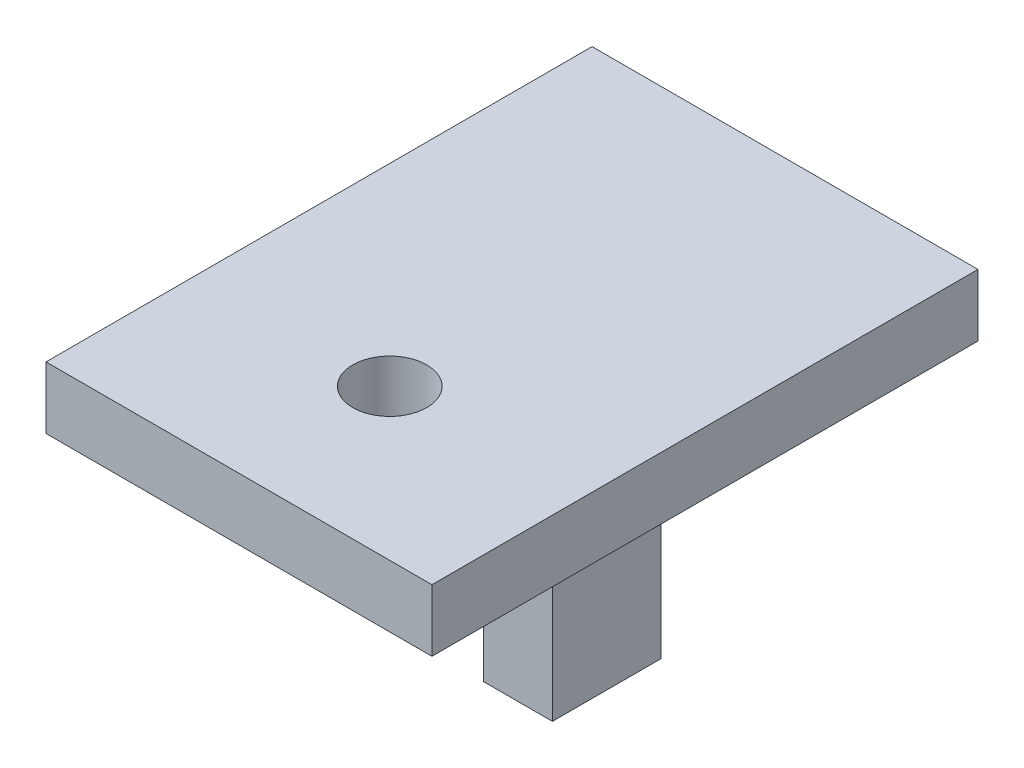
from build123d import *

# Parameters (mm, degrees)
SKETCH1_W           = 62.2
SKETCH1_H           = 88.01
BOSS_EXTRUDE1_DEPTH = 10
SKETCH2_R           = 5.969
CUT_EXTRUDE1_DEPTH  = 10
SKETCH3_W           = 11.09
SKETCH3_H           = 17.48264
BOSS_EXTRUDE2_DEPTH = 69.9


with BuildPart() as part:
    # Sketch1 → Boss-Extrude1 (new body)
    with BuildSketch(Plane(origin=(0, 0, 0), x_dir=(1, 0, 0), z_dir=(0, 1, 0))):
        with Locations((0, -3.512935)):
            Rectangle(SKETCH1_W, SKETCH1_H)
    extrude(amount=BOSS_EXTRUDE1_DEPTH)

    # Sketch2 → Cut-Extrude1 (cut)
    with BuildSketch(Plane(origin=(0, 10, 0), x_dir=(1, 0, 0), z_dir=(0, 1, 0))):
        with Locations((0, -23.217935)):
            Circle(SKETCH2_R)
    extrude(amount=-CUT_EXTRUDE1_DEPTH, mode=Mode.SUBTRACT)

    # Sketch3 → Boss-Extrude2 (add)
    with BuildSketch(Plane.XZ):
        with Locations((-25.555, -31.750745)):
            Rectangle(SKETCH3_W, SKETCH3_H)
    extrude(amount=BOSS_EXTRUDE2_DEPTH)


solid = part.part
